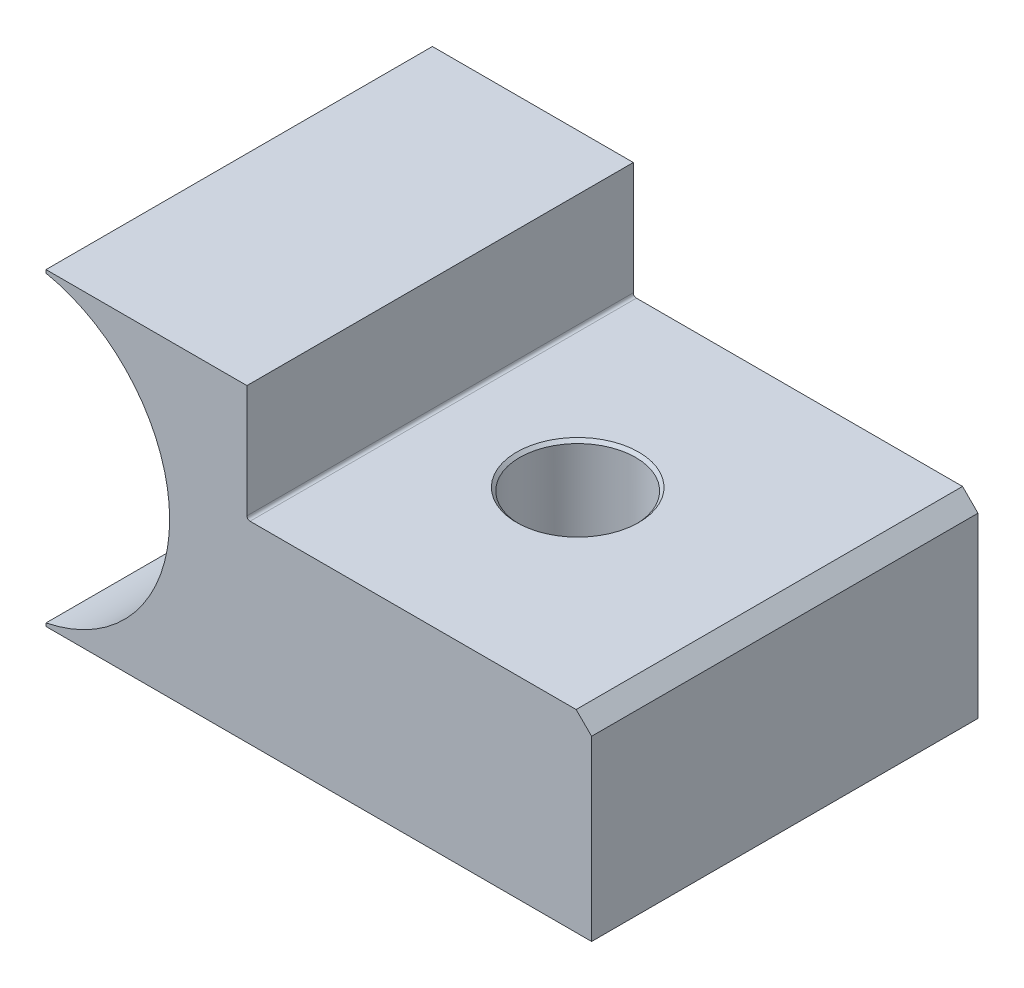
from build123d import *

# Parameters (mm, degrees)
BOSS_EXTRUDE1_DEPTH          = 31.75
F_3_8_0_375_DIAMETER_HOLE1_D = 9.525
CHAMFER1_SIZE                = 1.27
CHAMFER2_SIZE                = 0.254
FILLET1_R                    = 0.254


with BuildPart() as part:
    # Sketch1 → Boss-Extrude1 (new body)
    with BuildSketch(Plane.XY):
        with BuildLine():
            Line((2.54, 0), (47.371, 0))
            Line((47.371, 0), (47.371, 15.875))
            Line((47.371, 15.875), (19.05, 15.875))
            Line((19.05, 15.875), (19.05, 25.4))
            Line((19.05, 25.4), (2.54, 25.4))
            Line((2.54, 25.4), (2.54, 25.143407893))
            ThreePointArc((2.54, 25.143407893), (12.7, 12.7), (2.54, 0.256592107))
            Line((2.54, 0.256592107), (2.54, 0))
        make_face()
    extrude(amount=BOSS_EXTRUDE1_DEPTH)

    # 3/8 (0.375) Diameter Hole1 (through all)
    with Locations(Plane(origin=(0, 15.875, 0), x_dir=(1, 0, 0), z_dir=(0, 1, 0))):
        with Locations((30.353, -15.875)):
            Hole(F_3_8_0_375_DIAMETER_HOLE1_D / 2)

    # Chamfer1
    chamfer1_edges = [part.edges().sort_by_distance(p)[0] for p in [
        (47.371, 15.875, 15.875),
    ]]
    chamfer(chamfer1_edges, length=CHAMFER1_SIZE)

    # Chamfer2
    chamfer2_edges = [part.edges().sort_by_distance(p)[0] for p in [
        (35.1155, 15.875, 15.875),
    ]]
    chamfer(chamfer2_edges, length=CHAMFER2_SIZE)

    # Fillet1
    fillet1_edges = [part.edges().sort_by_distance(p)[0] for p in [
        (19.05, 15.875, 15.875),
    ]]
    fillet(fillet1_edges, radius=FILLET1_R)


solid = part.part
